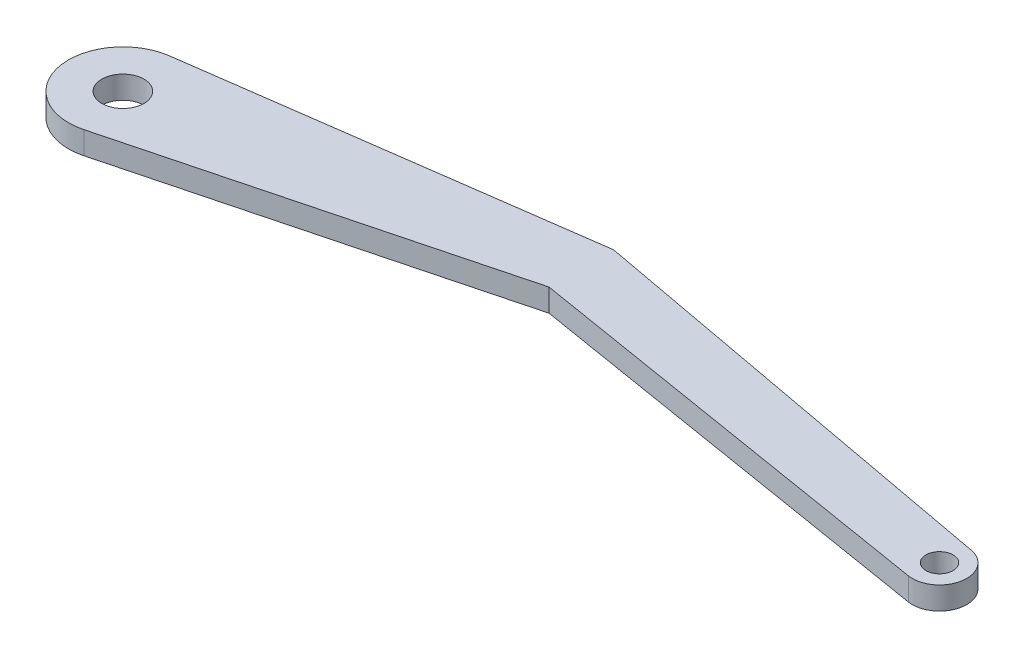
from build123d import *

# Parameters (mm, degrees)
SKETCH1_R           = 4.65
BOSS_EXTRUDE1_DEPTH = 5
SKETCH2_R           = 3
CUT_EXTRUDE1_DEPTH  = 188.585838445


with BuildPart() as part:
    # Sketch1 → Boss-Extrude1 (new body)
    with BuildSketch(Plane(origin=(0, 0, 0), x_dir=(1, 0, 0), z_dir=(0, 1, 0))):
        with BuildLine():
            Line((84.331894429, 23.82114156), (-1.649896938, 11.886035508))
            ThreePointArc((-1.649896938, 11.886035508), (-11.768996567, -2.343228502), (3.028514872, -11.611550184))
            Line((3.028514872, -11.611550184), (84.331894429, 9.593929724))
            Line((84.331894429, 9.593929724), (179.029914732, -5.921058569))
            ThreePointArc((179.029914732, -5.921058569), (185.910677913, -1.031448793), (181.092701345, 5.899661327))
            Line((181.092701345, 5.899661327), (84.331894429, 23.82114156))
        make_face()
        Circle(SKETCH1_R, mode=Mode.SUBTRACT)
    extrude(amount=BOSS_EXTRUDE1_DEPTH)

    # Sketch2 → Cut-Extrude1 (cut, through all)
    with BuildSketch(Plane(origin=(0, 5, 0), x_dir=(1, 0, 0), z_dir=(0, 1, 0))):
        with Locations((180, 0)):
            Circle(SKETCH2_R)
    extrude(amount=-CUT_EXTRUDE1_DEPTH, mode=Mode.SUBTRACT)


solid = part.part
